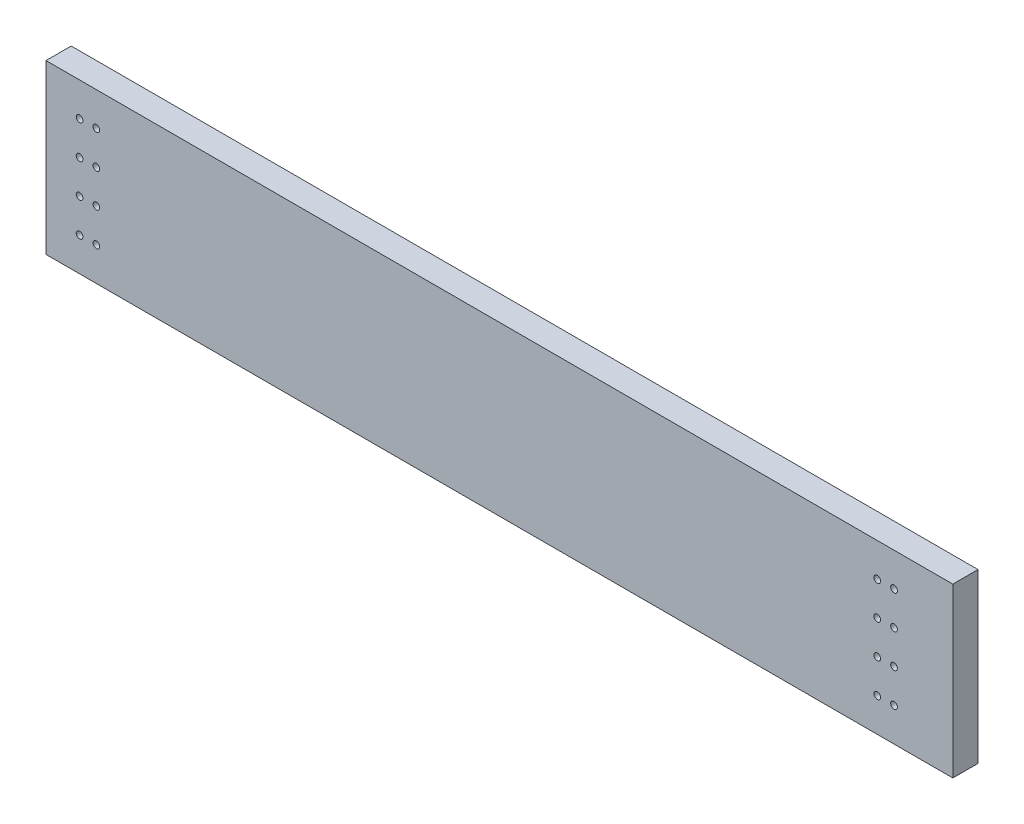
from build123d import *

# Parameters (mm, degrees)
SKETCH1_W           = 685.8
SKETCH1_H           = 127
BOSS_EXTRUDE1_DEPTH = 19.05
SKETCH2_R           = 2.54
CUT_EXTRUDE1_DEPTH  = 350.25


with BuildPart() as part:
    # Sketch1 → Boss-Extrude1 (new body)
    with BuildSketch(Plane.XY):
        Rectangle(SKETCH1_W, SKETCH1_H)
    extrude(amount=BOSS_EXTRUDE1_DEPTH)

    # Sketch2 → Cut-Extrude1 (cut, through all)
    with BuildSketch(Plane.XY.offset(19.05)):
        with Locations((298.45, 38.1)):
            Circle(SKETCH2_R)
        with Locations((298.45, 12.7)):
            Circle(SKETCH2_R)
        with Locations((298.45, -12.7)):
            Circle(SKETCH2_R)
        with Locations((298.45, -38.1)):
            Circle(SKETCH2_R)
        with Locations((285.75, -38.1)):
            Circle(SKETCH2_R)
        with Locations((285.75, -12.7)):
            Circle(SKETCH2_R)
        with Locations((285.75, 12.7)):
            Circle(SKETCH2_R)
        with Locations((285.75, 38.1)):
            Circle(SKETCH2_R)
        with Locations((-317.5, 38.1)):
            Circle(SKETCH2_R)
        with Locations((-304.8, 38.1)):
            Circle(SKETCH2_R)
        with Locations((-317.5, 12.7)):
            Circle(SKETCH2_R)
        with Locations((-304.8, 12.7)):
            Circle(SKETCH2_R)
        with Locations((-317.5, -12.7)):
            Circle(SKETCH2_R)
        with Locations((-304.8, -12.7)):
            Circle(SKETCH2_R)
        with Locations((-317.5, -38.1)):
            Circle(SKETCH2_R)
        with Locations((-304.8, -38.1)):
            Circle(SKETCH2_R)
    extrude(amount=-CUT_EXTRUDE1_DEPTH, mode=Mode.SUBTRACT)


solid = part.part
